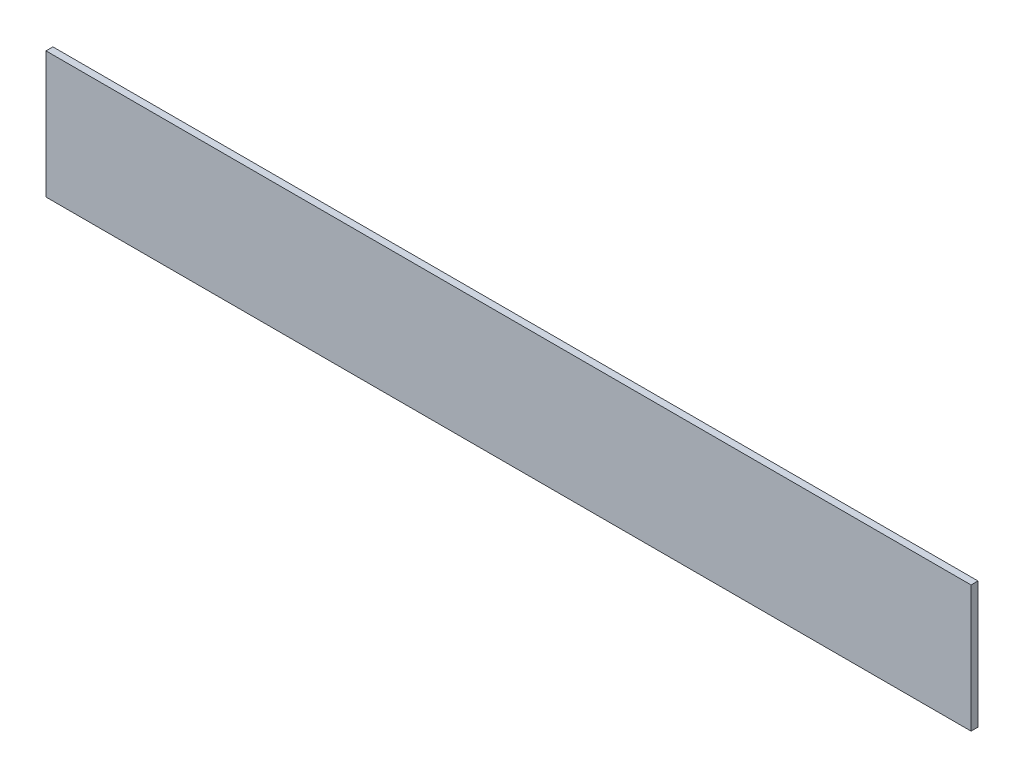
from build123d import *

# Parameters (mm, degrees)
SKETCH1_W           = 400
SKETCH1_H           = 54.75
BOSS_EXTRUDE1_DEPTH = 3


with BuildPart() as part:
    # Sketch1 → Boss-Extrude1 (new body)
    with BuildSketch(Plane.XY):
        with Locations((200, 27.375)):
            Rectangle(SKETCH1_W, SKETCH1_H)
    extrude(amount=BOSS_EXTRUDE1_DEPTH)


solid = part.part
